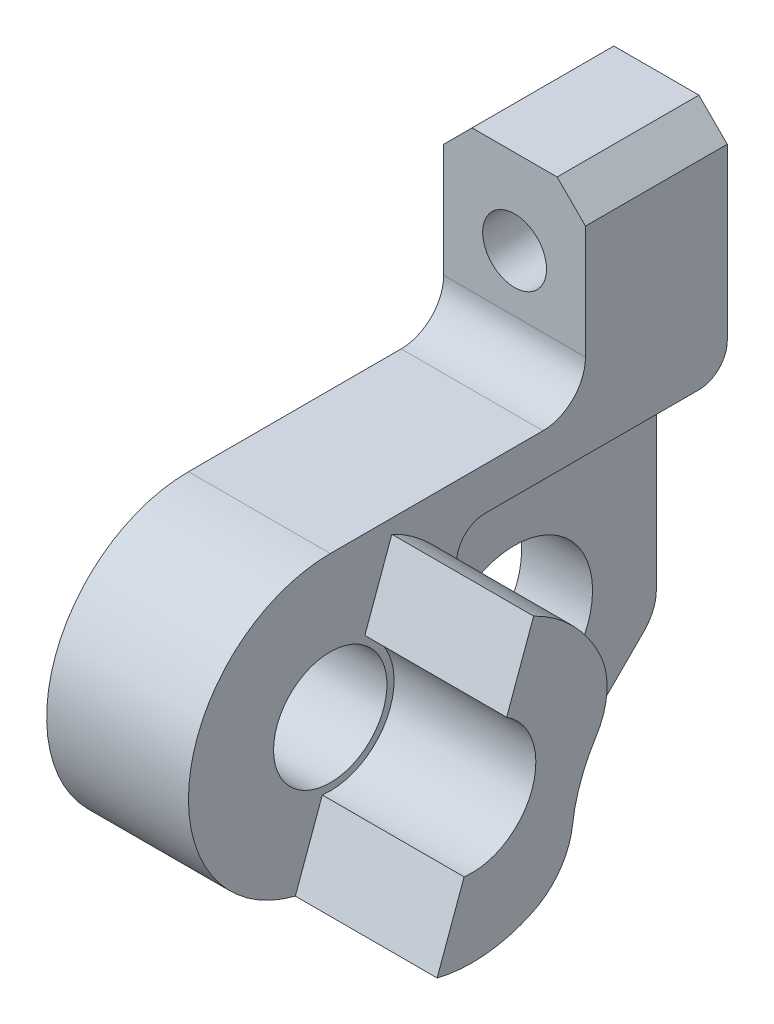
from build123d import *
from build123d.topology import SkipClean

# Parameters (mm, degrees)
SKETCH1_R           = 4
SKETCH1_R_2         = 5.5
BOSS_EXTRUDE1_DEPTH = 2.5
BOSS_EXTRUDE2_START = -5
SKETCH2_R           = 4
BOSS_EXTRUDE2_DEPTH = 5
SKETCH3_R           = 2.25
CUT_EXTRUDE1_DEPTH  = 38.003378224
CUT_EXTRUDE2_DEPTH  = 6
CHAMFER1_SIZE       = 2
FILLET1_R           = 5
BOSS_EXTRUDE3_DEPTH = 10


# Read off the part's stored shape, not the designer's step: Boss-Extrude3
with BuildPart() as part:
    # Sketch1 → Boss-Extrude1 (new, symmetric)
    with BuildSketch(Plane(origin=(0, 0, 0), x_dir=(0, 0, -1), z_dir=(1, 0, 0))):
        with BuildLine():
            Line((-3.149551455, -9.491065569), (15.007926117, -15.51651229))
            ThreePointArc((15.007926117, -15.51651229), (20.188852348, -15.744399678), (24.717514421, -13.217514421))
            Line((24.717514421, -13.217514421), (27.121320344, -10.813708499))
            ThreePointArc((27.121320344, -10.813708499), (27.771638598, -9.840438453), (28, -8.692388155))
            Line((28, -8.692388155), (28, 23))
            Line((28, 23), (18, 23))
            Line((18, 23), (18, 13))
            ThreePointArc((18, 13), (17.121320344, 10.878679656), (15, 10))
            Line((15, 10), (0, 10))
            ThreePointArc((0, 10), (-9.871946507, 1.595202857), (-3.149551455, -9.491065569))
        make_face()
        Circle(SKETCH1_R, mode=Mode.SUBTRACT)
        with Locations((18, -6.5)):
            Circle(SKETCH1_R_2, mode=Mode.SUBTRACT)
    extrude(amount=BOSS_EXTRUDE1_DEPTH, both=True)

    # Sketch2 → Boss-Extrude2 (add)
    with SkipClean():  # the faces are left unmerged after this step: merging them gives an invalid solid
        with BuildSketch(Plane.ZY.offset(-2.5).offset(BOSS_EXTRUDE2_START)):
            with BuildLine():
                Line((0, 10), (-15, 10))
                ThreePointArc((-15, 10), (-17.121320344, 10.878679656), (-18, 13))
                Line((-18, 13), (-18, 23))
                Line((-18, 23), (-28, 23))
                Line((-28, 23), (-28, 9))
                ThreePointArc((-28, 9), (-27.414213562, 7.585786438), (-26, 7))
                Line((-26, 7), (-10.908712115, 7))
                ThreePointArc((-10.908712115, 7), (-9.225461292, 6.08012345), (-9.090593429, 4.166666667))
                ThreePointArc((-9.090593429, 4.166666667), (-9.651431629, 2.617225154), (-9.950203687, 0.996717904))
                ThreePointArc((-9.950203687, 0.996717904), (-7.653907103, -2.763910898), (-7.017714401, -7.124021658))
                ThreePointArc((-7.017714401, -7.124021658), (9.253113438, -3.792082767), (0, 10))
            make_face()
            Circle(SKETCH2_R, mode=Mode.SUBTRACT)
        extrude(amount=BOSS_EXTRUDE2_DEPTH)

    # Sketch3 → Cut-Extrude1 (cut, through all)
    with SkipClean():  # the faces are left unmerged after this step: merging them gives an invalid solid
        with BuildSketch(Plane.XY.offset(-18)):
            with Locations((2.5, 17)):
                Circle(SKETCH3_R)
        extrude(amount=-CUT_EXTRUDE1_DEPTH, mode=Mode.SUBTRACT)

    # Sketch4 → Cut-Extrude2 (cut)
    with SkipClean():  # the faces are left unmerged after this step: merging them gives an invalid solid
        with BuildSketch(Plane(origin=(0, 0, -28), x_dir=(-1, 0, 0), z_dir=(0, 0, -1))):
            Polygon((-6.05, 14.950406544), (-2.5, 12.900813089), (1.05, 14.950406544), (1.05, 19.049593456), (-2.5, 21.099186911), (-6.05, 19.049593456), align=None)
        extrude(amount=-CUT_EXTRUDE2_DEPTH, mode=Mode.SUBTRACT)

    # Chamfer1
    chamfer1_edges = [part.edges().sort_by_distance(p)[0] for p in [
        (-2.5, 23, -23),
        (7.5, 23, -23),
    ]]
    chamfer(chamfer1_edges, length=CHAMFER1_SIZE)

    # Fillet1
    fillet1_edges = [part.edges().sort_by_distance(p)[0] for p in [
        (5, -7.124021658, -7.017714401),
        (5, 0.996717904, -9.950203687),
    ]]
    fillet(fillet1_edges, radius=FILLET1_R)

    # Boss-Extrude3 outline → Boss-Extrude3 (add)
    with SkipClean():  # the faces are left unmerged after this step: merging them gives an invalid solid
        with BuildSketch(Plane(origin=(7.5, 0, 0), x_dir=(0, 0, -1), z_dir=(1, 0, 0))):
            with BuildLine():
                ThreePointArc((-2.463364838, -9.691843668), (0.945667306, -9.955185249), (4.244142914, -9.054681161))
                ThreePointArc((4.244142914, -9.054681161), (6.167964396, -7.465154449), (7.083924127, -5.143796649))
                ThreePointArc((7.083924127, -5.143796649), (7.6539625, -2.763757496), (8.736132305, -0.568663276))
                ThreePointArc((8.736132305, -0.568663276), (9.511605201, 1.757812047), (9.087599302, 4.173192895))
                ThreePointArc((9.087599302, 4.173192895), (7.137011683, 7.00450314), (4.342750079, 9.007803381))
                Line((4.342750079, 9.007803381), (2.44029991, 3.780864498))
                ThreePointArc((2.44029991, 3.780864498), (4.228616794, -1.539090645), (-0.560914668, -4.464904785))
                Line((-0.560914668, -4.464904785), (-2.463364838, -9.691843668))
            make_face()
        extrude(amount=BOSS_EXTRUDE3_DEPTH)


solid = part.part
